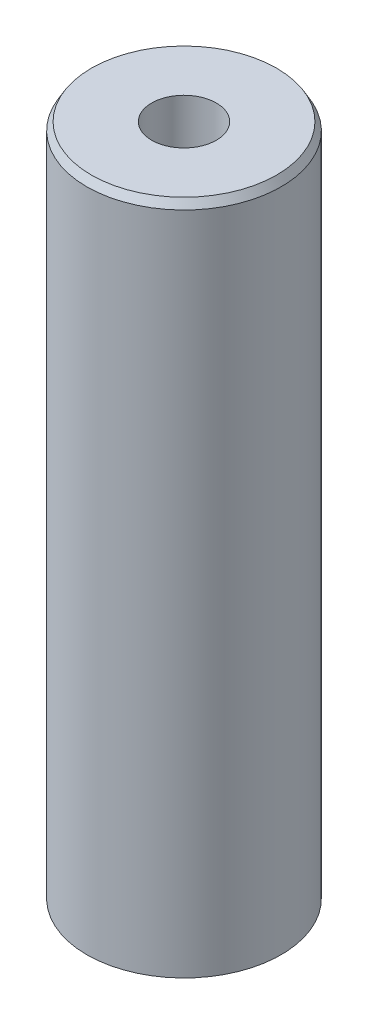
from build123d import *
from OCP.BRepFilletAPI import BRepFilletAPI_MakeChamfer

# Parameters (mm, degrees)
SKETCH1_R           = 45
BOSS_EXTRUDE1_DEPTH = 313.793971906
SKETCH2_R           = 14.966875803
CUT_EXTRUDE1_DEPTH  = 321.182224373
CHAMFER1_SIZE       = 3.651203617
CHAMFER1_SIZE2      = 2.108023391


with BuildPart() as part:
    # Sketch1 → Boss-Extrude1 (new body)
    with BuildSketch(Plane(origin=(0, 0, 0), x_dir=(1, 0, 0), z_dir=(0, 1, 0))):
        Circle(SKETCH1_R)
    extrude(amount=BOSS_EXTRUDE1_DEPTH)

    # Sketch2 → Cut-Extrude1 (cut, through all)
    with BuildSketch(Plane(origin=(0, 0, 0), x_dir=(1, 0, 0), z_dir=(0, 1, 0))):
        Circle(SKETCH2_R)
    extrude(amount=CUT_EXTRUDE1_DEPTH, mode=Mode.SUBTRACT)

    # Chamfer1: one chamfer whose edges measure the first distance from different faces: ONE call of the kernel's chamfer builder (chamfer() names one face for all edges)
    chamfer1_edges_1 = [part.edges().sort_by_distance(p)[0] for p in [
        (-45, 313.793971906, 0),
    ]]
    chamfer1_side_1 = [part.faces().sort_by_distance(p)[0] for p in [
        (-45, 156.896985953, 0),
    ]]
    chamfer1_edges_2 = [part.edges().sort_by_distance(p)[0] for p in [
        (-45, 0, 0),
    ]]
    chamfer1_side_2 = [part.faces().sort_by_distance(p)[0] for p in [
        (-43.727207794, 0, 0),
    ]]
    chamfer1 = BRepFilletAPI_MakeChamfer(part.part.solid().wrapped)
    for e in chamfer1_edges_1:
        chamfer1.Add(CHAMFER1_SIZE, CHAMFER1_SIZE2, e.wrapped, chamfer1_side_1[0].wrapped)  # the first distance lies on this face
    for e in chamfer1_edges_2:
        chamfer1.Add(CHAMFER1_SIZE, CHAMFER1_SIZE2, e.wrapped, chamfer1_side_2[0].wrapped)  # the first distance lies on this face
    add(Compound.cast(chamfer1.Shape()), mode=Mode.REPLACE)


solid = part.part
